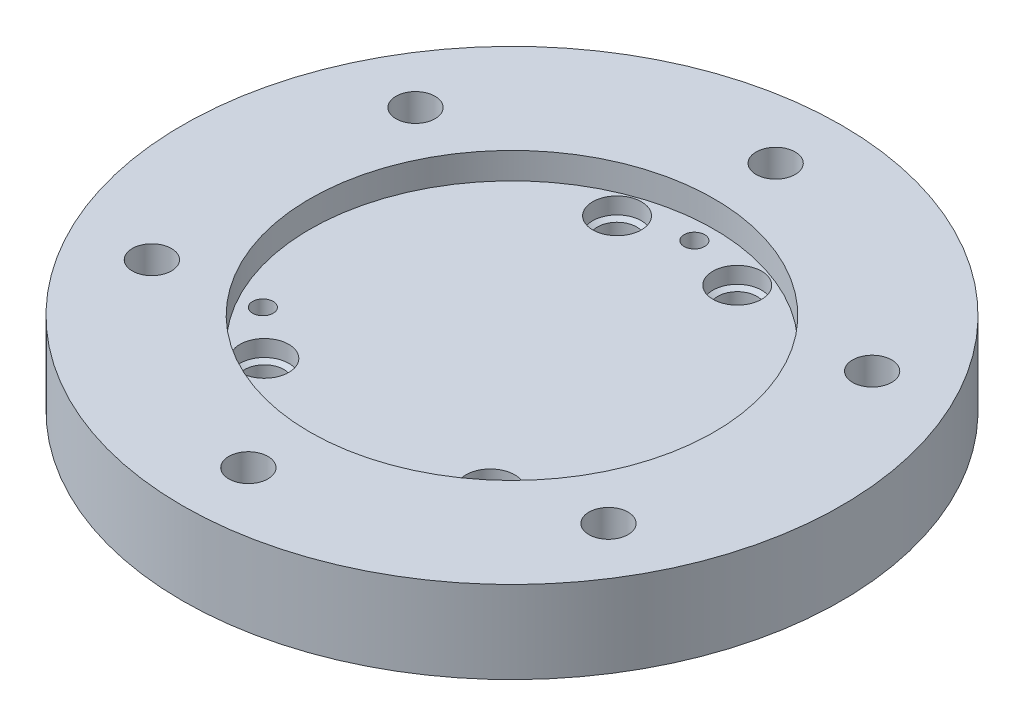
from build123d import *

# Parameters (mm, degrees)
OUTER_R                     = 19.05
BODY_DEPTH                  = 4.7625
INNER_R                     = 11.684
POCKET_DEPTH                = 1.524
F_4_40_TAPPED_HOLE3_D       = 2.2606
SCREW_HOLES_COUNT           = 6
F_0_80_TAPPED_HOLE1_D       = 1.19126
INNER_SCREW_HOLES_COUNT     = 3
F_43_0_089_DIAMETER_HOLE1_D = 2.2606


with BuildPart() as part:
    # outer → Body (new body)
    with BuildSketch(Plane(origin=(0, 0, 0), x_dir=(1, 0, 0), z_dir=(0, 1, 0))):
        Circle(OUTER_R)
    extrude(amount=-BODY_DEPTH)

    # inner → Pocket (cut)
    with BuildSketch(Plane(origin=(0, 0, 0), x_dir=(1, 0, 0), z_dir=(0, 1, 0))):
        Circle(INNER_R)
    extrude(amount=-POCKET_DEPTH, mode=Mode.SUBTRACT)

    # #4-40 Tapped Hole3 (through all)
    with Locations(Plane(origin=(0, 0, 0), x_dir=(1, 0, 0), z_dir=(0, 1, 0))):
        with Locations((0, -15.24)):
            f_4_40_tapped_hole3 = Hole(F_4_40_TAPPED_HOLE3_D / 2)

    # Screw Holes: #4-40 Tapped Hole3 ×6 about axis
    screw_holes_axis = Axis((0, 0.15875, 0), (0, -1, 0))
    for i in range(1, SCREW_HOLES_COUNT):
        add(f_4_40_tapped_hole3.rotate(screw_holes_axis, i * 360 / SCREW_HOLES_COUNT), mode=Mode.SUBTRACT)

    # #0-80 Tapped Hole1 (through all)
    with Locations(Plane(origin=(0, -1.524, 0), x_dir=(1, 0, 0), z_dir=(0, 1, 0))):
        with Locations((0, 10.541)):
            f_0_80_tapped_hole1 = Hole(F_0_80_TAPPED_HOLE1_D / 2)

    # Inner Screw Holes: #0-80 Tapped Hole1 ×3 about axis
    inner_screw_holes_axis = Axis((0, 0.15875, 0), (0, -1, 0))
    for i in range(1, INNER_SCREW_HOLES_COUNT):
        add(f_0_80_tapped_hole1.rotate(inner_screw_holes_axis, i * 360 / INNER_SCREW_HOLES_COUNT), mode=Mode.SUBTRACT)

    # #43 (0.089) Diameter Hole1 (through all)
    with Locations(Plane(origin=(0, -1.524, 0), x_dir=(1, 0, 0), z_dir=(0, 1, 0))):
        with Locations((-3.474924656, 9.547277027)):
            f_43_0_089_diameter_hole1 = Hole(F_43_0_089_DIAMETER_HOLE1_D / 2)

    # Sketch23 → #34 (0.111) Diameter Hole1 (revolve, cut)
    with BuildSketch(Plane(origin=(-3.474924656, -1.524, -9.547277027), x_dir=(0, 0, 1), z_dir=(1, 0, 0))):
        Polygon((0, 0), (0, 1.799533215), (1.4097, 0.9525), (1.4097, 0), align=None)
    f_34_0_111_diameter_hole1 = revolve(axis=Axis((-3.474924656, 4.826, -9.547277027), (0, -1, 0)), mode=Mode.SUBTRACT)

    # Sketch27 → #34 (0.111) Diameter Hole2 (revolve, cut)
    with BuildSketch(Plane(origin=(-3.474924656, -4.7625, -9.547277027), x_dir=(0, 0, -1), z_dir=(1, 0, 0))):
        Polygon((0, 0), (0, 1.799533215), (1.4097, 0.9525), (1.4097, 0), align=None)
    f_34_0_111_diameter_hole2 = revolve(axis=Axis((-3.474924656, -11.1125, -9.547277027), (0, 1, 0)), mode=Mode.SUBTRACT)

    # IO Holes Pattern: #43 (0.089) Diameter Hole1, #34 (0.111) Diameter Hole1, #34 (0.111) Diameter Hole2 at 3 more places
    with Locations((6.949849, 0, 0), (-3.055797, 0, 17.330289), (10.005647, 0, 17.330289)):
        add(f_43_0_089_diameter_hole1, mode=Mode.SUBTRACT)
        add(f_34_0_111_diameter_hole1, mode=Mode.SUBTRACT)
        add(f_34_0_111_diameter_hole2, mode=Mode.SUBTRACT)


solid = part.part
